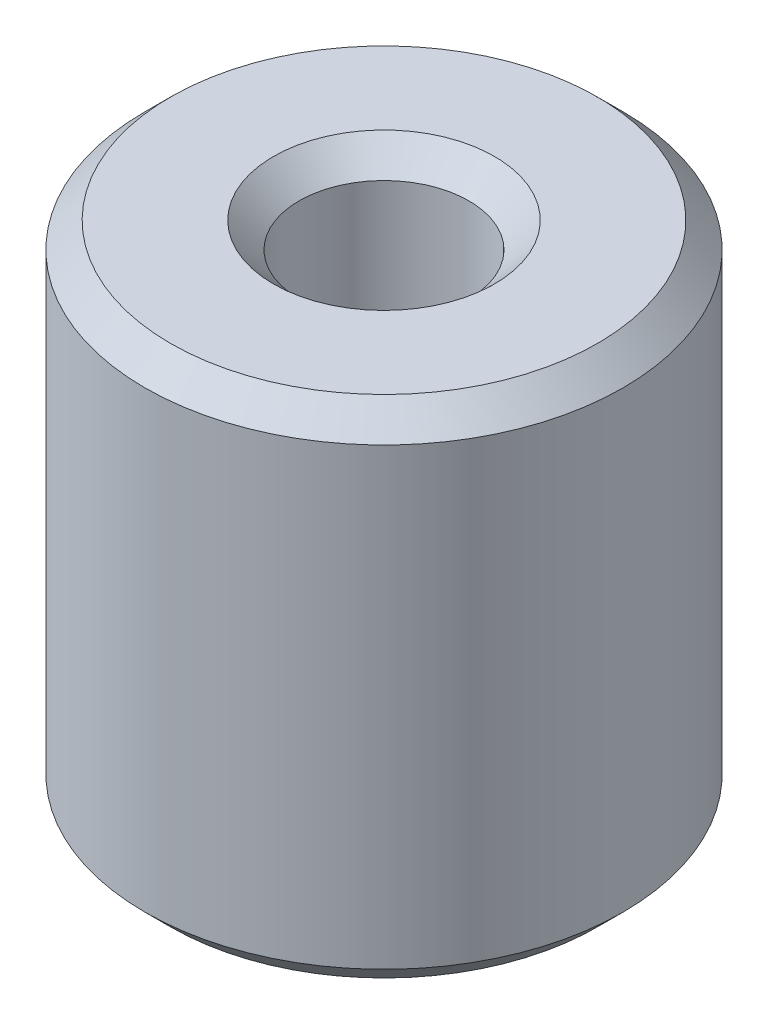
from build123d import *

# Parameters (mm, degrees)
SKETCH1_R           = 5
BOSS_EXTRUDE1_DEPTH = 10.567492003
SKETCH2_R           = 1.775299571
CUT_EXTRUDE1_DEPTH  = 13.715026041
CHAMFER1_SIZE       = 0.535906303


with BuildPart() as part:
    # Sketch1 → Boss-Extrude1 (new body)
    with BuildSketch(Plane(origin=(0, 0, 0), x_dir=(1, 0, 0), z_dir=(0, 1, 0))):
        Circle(SKETCH1_R)
    extrude(amount=BOSS_EXTRUDE1_DEPTH)

    # Sketch2 → Cut-Extrude1 (cut, through all)
    with BuildSketch(Plane(origin=(0, 0, 0), x_dir=(1, 0, 0), z_dir=(0, 1, 0))):
        Circle(SKETCH2_R)
    extrude(amount=CUT_EXTRUDE1_DEPTH, mode=Mode.SUBTRACT)

    # Chamfer1
    chamfer1_edges = [part.edges().sort_by_distance(p)[0] for p in [
        (-1.775299571, 10.567492003, 0),
        (-1.775299571, 0, 0),
        (-5, 0, 0),
        (-5, 10.567492003, 0),
    ]]
    chamfer(chamfer1_edges, length=CHAMFER1_SIZE)


solid = part.part
